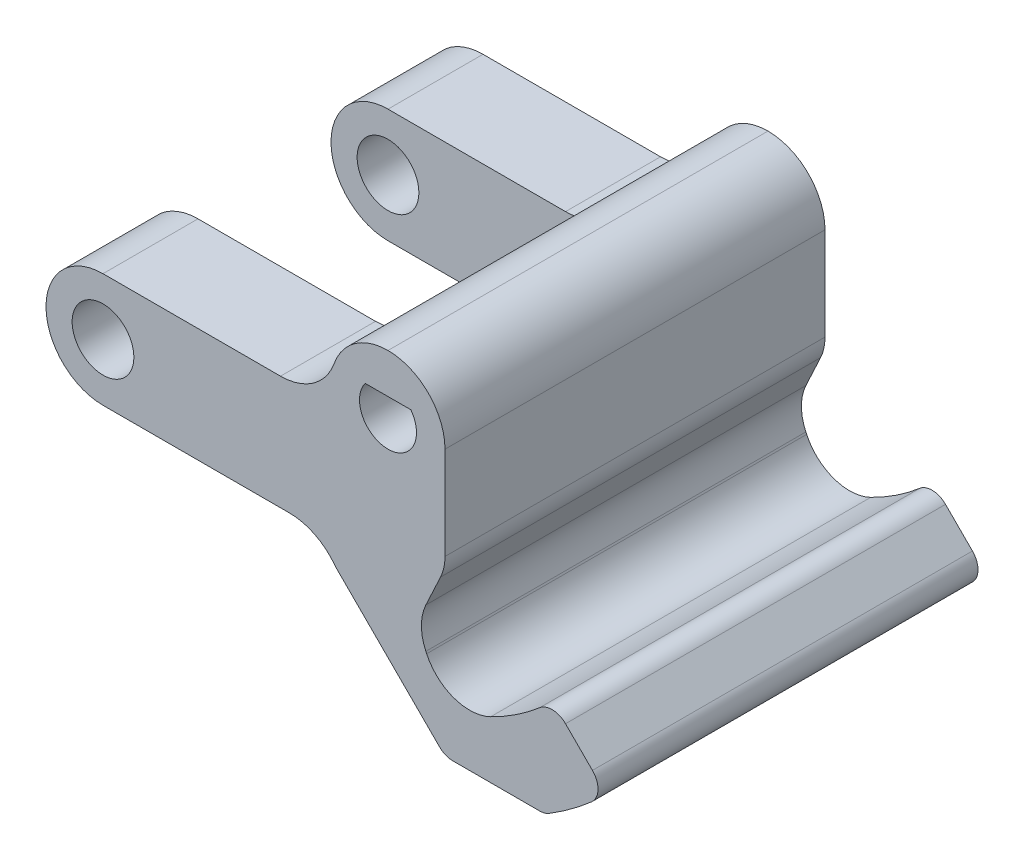
from build123d import *

# Parameters (mm, degrees)
SKETCH2_R            = 3
BOSS_EXTRUDE1_DEPTH  = 20
FILLET1_R            = 6
FILLET2_R            = 2
FILLET4_R            = 5
SKETCH3_W            = 30
SKETCH3_H            = 12
SKETCH3_R            = 3.25
BOSS_EXTRUDE2_DEPTH  = 10
FILLET3_R            = 6
FILLET3_OF_MIRROR1_R = 6
BOSS_EXTRUDE3_DEPTH  = 40


# Some blends are built 0.0001 mm under size
with BuildPart() as part:
    # Sketch2 → Boss-Extrude1 (new, symmetric)
    with BuildSketch(Plane.XY):
        with BuildLine():
            Line((-6, 6), (6, 6))
            Line((6, 6), (6, -10.886905517))
            Line((6, -10.886905517), (3, -17.320426279))
            Line((3, -17.320426279), (6, -23.75394704))
            ThreePointArc((6, -23.75394704), (12.097077324, -21.305180596), (17.324116139, -17.324116139))
            Line((17.324116139, -17.324116139), (22.980970389, -22.980970389))
            ThreePointArc((22.980970389, -22.980970389), (19.899357283, -25.695633476), (16.5, -28))
            Line((16.5, -28), (6, -28))
            Line((6, -28), (-6, -16))
            Line((-6, -16), (-6, 6))
        make_face()
        Circle(SKETCH2_R, mode=Mode.SUBTRACT)
    extrude(amount=BOSS_EXTRUDE1_DEPTH, both=True)

    # Fillet1
    fillet1_edges = [part.edges().sort_by_distance(p)[0] for p in [
        (6, 6, 0),
        (-6, 6, 0),
    ]]
    fillet(fillet1_edges, radius=FILLET1_R - 0.0001)  # a hair under: the kernel refuses the full size

    # Fillet2
    fillet2_edges = [part.edges().sort_by_distance(p)[0] for p in [
        (17.324116139, -17.324116139, 0),
        (22.980970389, -22.980970389, 0),
        (16.5, -28, 0),
        (6, -28, 0),
        (-6, -16, 0),
    ]]
    fillet(fillet2_edges, radius=FILLET2_R)

    # Fillet4
    fillet4_edges = [part.edges().sort_by_distance(p)[0] for p in [
        (6, -10.886905517, 0),
        (3, -17.320426279, 0),
        (6, -23.75394704, 0),
    ]]
    fillet(fillet4_edges, radius=FILLET4_R)

    # Sketch3 → Boss-Extrude2 (add)
    with BuildSketch(Plane.XY.offset(20)):
        with Locations((-21, -8)):
            Rectangle(SKETCH3_W, SKETCH3_H)
        with Locations((-30, -8)):
            Circle(SKETCH3_R, mode=Mode.SUBTRACT)
    boss_extrude2 = extrude(amount=-BOSS_EXTRUDE2_DEPTH)

    # Fillet3
    # the kernel refuses this fillet: 6 mm, written as the material it adds along each edge
    with BuildSketch(Plane(origin=(-6, -14, 20), x_dir=(0.16798992441845362, -0.9857887122978647, 0), z_dir=(0, 0, -1))) as fillet3_piece_1:
        with BuildLine():
            CenterArc((5.179174836, 5.324294957), FILLET3_R, 189.670969531, 52.875183342)
            Line((-0.735557438, 4.316355411), (-1.327030665, 4.215561456))
            Line((-1.327030665, 4.215561456), (-0.591473227, -0.100793955))
            Line((-0.591473227, -0.100793955), (0.100793955, -0.591473227))
            ThreePointArc((0.100793955, -0.591473227), (1.255717271, -0.394660789), (2.136350707, -0.532429496))
            Line((2.136350707, -0.532429496), (2.412971083, 0))
        make_face()
    extrude(amount=10)
    with BuildSketch(Plane(origin=(-6, -2, 20), x_dir=(0.08546746952976336, 0.9963409615448815, 0), z_dir=(0, 0, -1))) as fillet3_piece_2:
        with BuildLine():
            CenterArc((5.523894047, -5.807099434), FILLET3_R, 104.567976289, 70.529116987)
            Line((-0.454151722, -5.294294617), (-1.051956299, -5.243014135))
            Line((-1.051956299, -5.243014135), (-0.597804577, 0.051280482))
            Line((-0.597804577, 0.051280482), (0.051280482, 0.597804577))
            ThreePointArc((0.051280482, 0.597804577), (2.044062039, 0.426861091), (3.863806292, 0.580709943))
            Line((3.863806292, 0.580709943), (4.014723361, 0))
        make_face()
    extrude(amount=10)
    # the kernel refuses this fillet: 6 mm, written as the material it takes off along each edge
    with BuildSketch(Plane(origin=(-36, -14, 35), x_dir=(0, 1, 0), z_dir=(0, 0, -1)), Plane(origin=(-36, -2, 35), x_dir=(1, 0, 0), z_dir=(0, 0, -1))) as fillet3_2_piece_1:
        with BuildLine():
            CenterArc((FILLET3_R, FILLET3_R), FILLET3_R, 180, 90)
            Line((0, FILLET3_R), (0, 0))
            Line((0, 0), (FILLET3_R, 0))
        make_face()
    extrude(amount=40, mode=Mode.SUBTRACT)

    # Mirror1: Boss-Extrude2 across plane
    add(boss_extrude2.mirror(Plane.XY))

    # Fillet3 of Mirror1
    # the kernel refuses this fillet: 6 mm, written as the material it adds along each edge
    with BuildSketch(Plane(origin=(-6, -14, -20), x_dir=(0.16798992441845362, -0.9857887122978647, 0), z_dir=(0, 0, 1))) as fillet3_of_mirror1_piece_1:
        with BuildLine():
            CenterArc((5.179174836, -5.324294957), FILLET3_OF_MIRROR1_R, 117.453847127, 52.875183342)
            Line((-0.735557438, -4.316355411), (-1.327030665, -4.215561456))
            Line((-1.327030665, -4.215561456), (-0.591473227, 0.100793955))
            Line((-0.591473227, 0.100793955), (0.100793955, 0.591473227))
            ThreePointArc((0.100793955, 0.591473227), (1.255717271, 0.394660789), (2.136350707, 0.532429496))
            Line((2.136350707, 0.532429496), (2.412971083, 0))
        make_face()
    extrude(amount=10)
    with BuildSketch(Plane(origin=(-6, -2, -20), x_dir=(0.08546746952976336, 0.9963409615448815, 0), z_dir=(0, 0, 1))) as fillet3_of_mirror1_piece_2:
        with BuildLine():
            CenterArc((5.523894047, 5.807099434), FILLET3_OF_MIRROR1_R, 184.902906724, 70.529116987)
            Line((-0.454151722, 5.294294617), (-1.051956299, 5.243014135))
            Line((-1.051956299, 5.243014135), (-0.597804577, -0.051280482))
            Line((-0.597804577, -0.051280482), (0.051280482, -0.597804577))
            ThreePointArc((0.051280482, -0.597804577), (2.044062039, -0.426861091), (3.863806292, -0.580709943))
            Line((3.863806292, -0.580709943), (4.014723361, 0))
        make_face()
    extrude(amount=10)
    # the kernel refuses this fillet: 6 mm, written as the material it takes off along each edge
    with BuildSketch(Plane(origin=(-36, -14, -35), x_dir=(1, 0, 0), z_dir=(0, 0, 1)), Plane(origin=(-36, -2, -35), x_dir=(0, -1, 0), z_dir=(0, 0, 1))) as fillet3_of_mirror1_2_piece_1:
        with BuildLine():
            CenterArc((FILLET3_OF_MIRROR1_R, FILLET3_OF_MIRROR1_R), FILLET3_OF_MIRROR1_R, 180, 90)
            Line((0, FILLET3_OF_MIRROR1_R), (0, 0))
            Line((0, 0), (FILLET3_OF_MIRROR1_R, 0))
        make_face()
    extrude(amount=40, mode=Mode.SUBTRACT)

    # Sketch4 → Boss-Extrude3 (add)
    with BuildSketch(Plane(origin=(0, 0, -20), x_dir=(-1, 0, 0), z_dir=(0, 0, -1))):
        with BuildLine():
            Line((-2.4, 1.8), (2.4, 1.8))
            ThreePointArc((2.4, 1.8), (0, 3), (-2.4, 1.8))
        make_face()
    extrude(amount=-BOSS_EXTRUDE3_DEPTH)


solid = part.part
